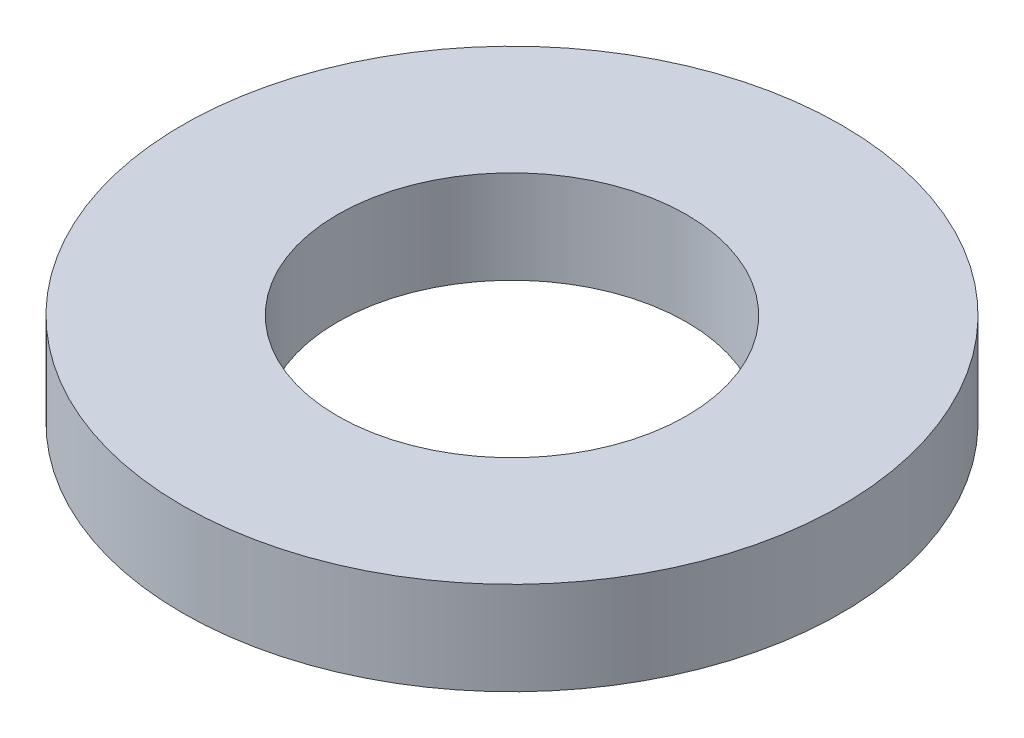
from build123d import *

# Parameters (mm, degrees)
SKETCH1_R           = 85
BOSS_EXTRUDE1_DEPTH = 24
SKETCH2_R           = 45
CUT_EXTRUDE1_DEPTH  = 123.580585739


with BuildPart() as part:
    # Sketch1 → Boss-Extrude1 (new body)
    with BuildSketch(Plane(origin=(0, 0, 0), x_dir=(1, 0, 0), z_dir=(0, 1, 0))):
        Circle(SKETCH1_R)
    extrude(amount=BOSS_EXTRUDE1_DEPTH)

    # Sketch2 → Cut-Extrude1 (cut, through all)
    with BuildSketch(Plane(origin=(0, 0, 0), x_dir=(1, 0, 0), z_dir=(0, 1, 0))):
        Circle(SKETCH2_R)
    extrude(amount=CUT_EXTRUDE1_DEPTH, mode=Mode.SUBTRACT)


solid = part.part
